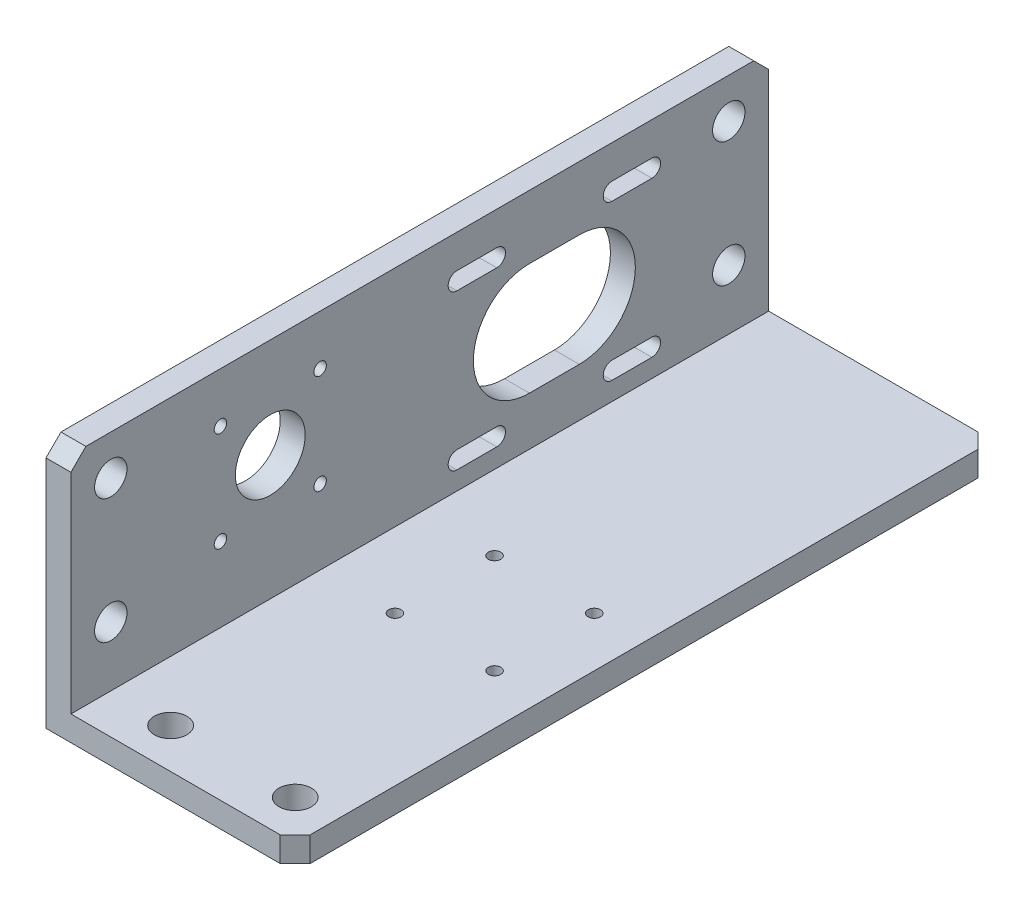
from build123d import *

# Parameters (mm, degrees)
ESTRUSIONE_ESTRUSIONE1_DEPTH = 140
FORO_6_5_6_5_1_D             = 6.5
FORO_6_5_6_5_2_AT_2_COUNT    = 2
FORO_6_5_6_5_2_AT_2_PITCH    = 25
TAGLIO_ESTRUSIONE2_REACH     = 158.844
SCHIZZO9_R                   = 7
TAGLIO_ESTRUSIONE4_REACH     = 158.844
SMUSSO1_SIZE                 = 3
M3_TAPPED_HOLE1_D            = 2.5
M3_TAPPED_HOLE2_D            = 2.5


with BuildPart() as part:
    # Schizzo1 → Estrusione-Estrusione1 (new body)
    with BuildSketch(Plane.XY):
        Polygon((0, 0), (0, 50), (5, 50), (5, 5), (50, 5), (50, 0), align=None)
    extrude(amount=ESTRUSIONE_ESTRUSIONE1_DEPTH)

    # Foro Ø6.5 (6.5)-1 (through all)
    with Locations(Plane(origin=(0, 0, 0), x_dir=(-1, 0, 0), z_dir=(0, -1, 0))):
        with Locations((-17, -132), (-42, -132)):
            Hole(FORO_6_5_6_5_1_D / 2)

    # Schizzo6 → Foro Ø6.5 (6.5)-2 (revolve, cut)
    with BuildSketch(Plane(origin=(0, 42, 132), x_dir=(0, 0, 1), z_dir=(0, 1, 0))):
        Polygon((0, 0), (0, 6.952797012), (3.25, 5), (3.25, 0), align=None)
    foro_6_5_6_5_2 = revolve(axis=Axis((-6.35, 42, 132), (1, 0, 0)), mode=Mode.SUBTRACT)

    # Foro Ø6.5 (6.5)-2 at 2: Foro Ø6.5 (6.5)-2 ×2
    with Locations(*[(0, -i * FORO_6_5_6_5_2_AT_2_PITCH, 0) for i in range(1, FORO_6_5_6_5_2_AT_2_COUNT)]):
        add(foro_6_5_6_5_2, mode=Mode.SUBTRACT)

    # Specchia1: Foro Ø6.5 (6.5)-2 across plane
    add(foro_6_5_6_5_2.mirror(Plane.XY.offset(70)), mode=Mode.SUBTRACT)

    # Specchia1 copy 1 sketch → Specchia1 copy 1 (revolve, cut)
    with BuildSketch(Plane(origin=(0, 17, 8), x_dir=(0, 0, -1), z_dir=(0, 1, 0))):
        Polygon((0, 0), (0, -6.952797012), (3.25, -5), (3.25, 0), align=None)
    revolve(axis=Axis((-6.35, 17, 8), (-1, 0, 0)), mode=Mode.SUBTRACT)

    # Schizzo9 → Taglio-Estrusione2 (cut, up to next)
    with BuildSketch(Plane.ZY, mode=Mode.PRIVATE) as taglio_estrusione2_sk1:
        with Locations((100, 30)):
            Circle(SCHIZZO9_R)
    taglio_estrusione2_tool1 = extrude(taglio_estrusione2_sk1.sketch, amount=-TAGLIO_ESTRUSIONE2_REACH, mode=Mode.PRIVATE) & part.part
    add(taglio_estrusione2_tool1.solids().sort_by_distance((0, 30, 100))[0], mode=Mode.SUBTRACT)

    # Schizzo11 → Taglio-Estrusione4 (cut, up to next)
    with BuildSketch(Plane.ZY, mode=Mode.PRIVATE) as taglio_estrusione4_sk1:
        with BuildLine():
            Line((62.556349186, 39.806349186), (54.556349186, 39.806349186))
            ThreePointArc((54.556349186, 39.806349186), (52.806349186, 41.556349186), (54.556349186, 43.306349186))
            Line((54.556349186, 43.306349186), (62.556349186, 43.306349186))
            ThreePointArc((62.556349186, 43.306349186), (64.306349186, 41.556349186), (62.556349186, 39.806349186))
        make_face()
    taglio_estrusione4_tool1 = extrude(taglio_estrusione4_sk1.sketch, amount=-TAGLIO_ESTRUSIONE4_REACH, mode=Mode.PRIVATE) & part.part
    # Schizzo11 → Taglio-Estrusione4 (cut, up to next)
    with BuildSketch(Plane.ZY, mode=Mode.PRIVATE) as taglio_estrusione4_sk2:
        with BuildLine():
            Line((62.556349186, 12.193650814), (54.556349186, 12.193650814))
            ThreePointArc((54.556349186, 12.193650814), (52.806349186, 10.443650814), (54.556349186, 8.693650814))
            Line((54.556349186, 8.693650814), (62.556349186, 8.693650814))
            ThreePointArc((62.556349186, 8.693650814), (64.306349186, 10.443650814), (62.556349186, 12.193650814))
        make_face()
    taglio_estrusione4_tool2 = extrude(taglio_estrusione4_sk2.sketch, amount=-TAGLIO_ESTRUSIONE4_REACH, mode=Mode.PRIVATE) & part.part
    # Schizzo11 → Taglio-Estrusione4 (cut, up to next)
    with BuildSketch(Plane.ZY, mode=Mode.PRIVATE) as taglio_estrusione4_sk3:
        with BuildLine():
            Line((23.443650814, 12.193650814), (31.443650814, 12.193650814))
            ThreePointArc((31.443650814, 12.193650814), (33.193650814, 10.443650814), (31.443650814, 8.693650814))
            Line((31.443650814, 8.693650814), (23.443650814, 8.693650814))
            ThreePointArc((23.443650814, 8.693650814), (21.693650814, 10.443650814), (23.443650814, 12.193650814))
        make_face()
    taglio_estrusione4_tool3 = extrude(taglio_estrusione4_sk3.sketch, amount=-TAGLIO_ESTRUSIONE4_REACH, mode=Mode.PRIVATE) & part.part
    # Schizzo11 → Taglio-Estrusione4 (cut, up to next)
    with BuildSketch(Plane.ZY, mode=Mode.PRIVATE) as taglio_estrusione4_sk4:
        with BuildLine():
            Line((23.443650814, 39.806349186), (31.443650814, 39.806349186))
            ThreePointArc((31.443650814, 39.806349186), (33.193650814, 41.556349186), (31.443650814, 43.306349186))
            Line((31.443650814, 43.306349186), (23.443650814, 43.306349186))
            ThreePointArc((23.443650814, 43.306349186), (21.693650814, 41.556349186), (23.443650814, 39.806349186))
        make_face()
    taglio_estrusione4_tool4 = extrude(taglio_estrusione4_sk4.sketch, amount=-TAGLIO_ESTRUSIONE4_REACH, mode=Mode.PRIVATE) & part.part
    # Schizzo11 → Taglio-Estrusione4 (cut, up to next)
    with BuildSketch(Plane.ZY, mode=Mode.PRIVATE) as taglio_estrusione4_sk5:
        with BuildLine():
            Line((48, 14.75), (38, 14.75))
            ThreePointArc((38, 14.75), (26.75, 26), (38, 37.25))
            Line((38, 37.25), (48, 37.25))
            ThreePointArc((48, 37.25), (59.25, 26), (48, 14.75))
        make_face()
    taglio_estrusione4_tool5 = extrude(taglio_estrusione4_sk5.sketch, amount=-TAGLIO_ESTRUSIONE4_REACH, mode=Mode.PRIVATE) & part.part
    add(taglio_estrusione4_tool1.solids().sort_by_distance((0, 41.556349, 58.556349))[0], mode=Mode.SUBTRACT)
    add(taglio_estrusione4_tool2.solids().sort_by_distance((0, 10.443651, 58.556349))[0], mode=Mode.SUBTRACT)
    add(taglio_estrusione4_tool3.solids().sort_by_distance((0, 10.443651, 27.443651))[0], mode=Mode.SUBTRACT)
    add(taglio_estrusione4_tool4.solids().sort_by_distance((0, 41.556349, 27.443651))[0], mode=Mode.SUBTRACT)
    add(taglio_estrusione4_tool5.solids().sort_by_distance((0, 26, 43))[0], mode=Mode.SUBTRACT)

    # Smusso1
    smusso1_edges = [part.edges().sort_by_distance(p)[0] for p in [
        (50, 2.5, 0),
        (2.5, 50, 0),
        (2.5, 50, 140),
        (50, 2.5, 140),
    ]]
    chamfer(smusso1_edges, length=SMUSSO1_SIZE)

    # M3 Tapped Hole1 (through all)
    with Locations(Plane(origin=(0, 40, 90), x_dir=(0, 0, -1), z_dir=(-1, 0, 0))):
        with Locations((0, 0), (-20, 0), (-20, 20), (0, 20)):
            Hole(M3_TAPPED_HOLE1_D / 2)

    # M3 Tapped Hole2 (through all)
    with Locations(Plane(origin=(20, 0, 90), x_dir=(-1, 0, 0), z_dir=(0, -1, 0))):
        with Locations((0, 0), (-20, 0), (-20, 20), (0, 20)):
            Hole(M3_TAPPED_HOLE2_D / 2)


solid = part.part
